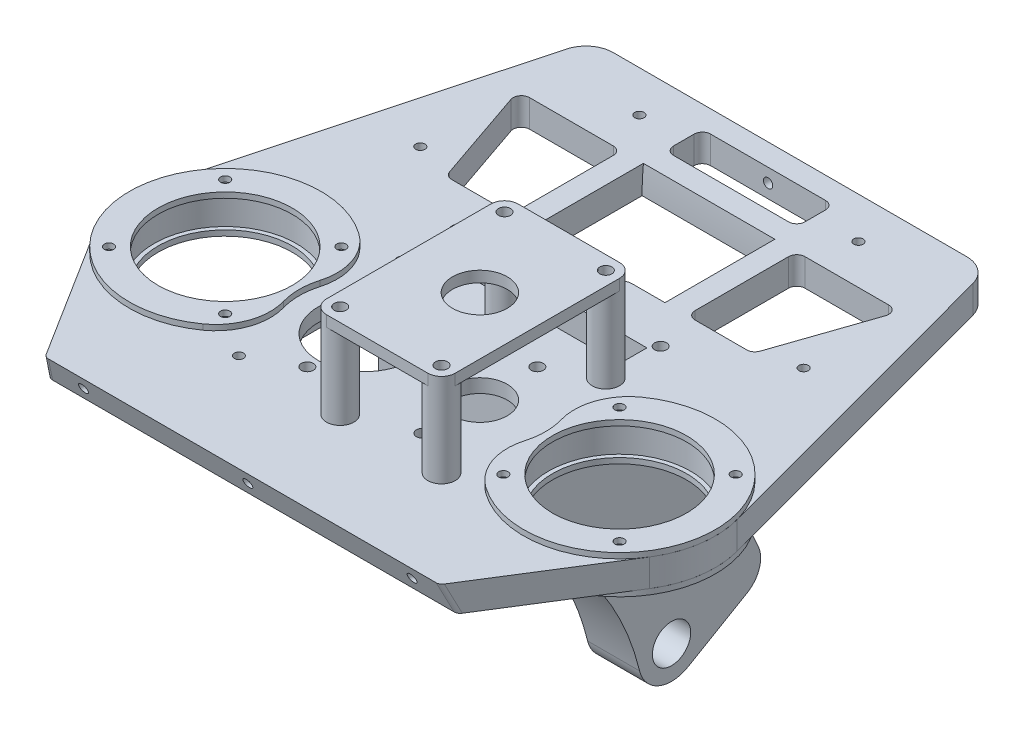
from build123d import *

# Parameters (mm, degrees)
EXTRUDE_1_DEPTH          = 2.5
EXTRUDE_1_DEPTH_BACK     = 2.5
SKETCH_1_R               = 13
SKETCH_1_R_2             = 1.1
SKETCH_1_R_3             = 5
SKETCH_1_R_4             = 8.5
SKETCH_1_R_5             = 0.85
SKETCH_2_R               = 1.1
SKETCH_2_R_2             = 12.25
EXTRUDE_2_DEPTH          = 1
MIRROR_START             = -3.5
MIRROR_1_OUTLINE_R       = 1.1
MIRROR_1_OUTLINE_R_2     = 12.25
MIRROR_1_DEPTH           = 1
MIRROR_START_2           = 2.5
MIRROR_1_2_OUTLINE_R     = 1.1
MIRROR_1_2_OUTLINE_R_2   = 12.25
MIRROR_1_2_DEPTH         = 1
EXTRUDE_START            = -1
SKETCH_38_R              = 1.1
SKETCH_38_R_2            = 0.85
EXTRUDE_10_DEPTH         = 1
SKETCH_3_W               = 36
SKETCH_3_H               = 26
CUT_EXTRUDE_1_DEPTH      = 2.5
SKETCH_6_R               = 1.1
EXTRUDE_3_DEPTH          = 2
SKETCH_16_R              = 3.5
EXTRUDE_6_DEPTH          = 6
EXTRUDE_7_DEPTH          = 33.5
EXTRUDE_7_DEPTH_BACK     = 3
SKETCH_17_R              = 3.5
CUT_EXTRUDE_7_DEPTH      = 12
CUT_EXTRUDE_7_DEPTH_BACK = 12
SKETCH_24_R              = 22.5
CUT_EXTRUDE_8_REACH      = 83.241
CUT_EXTRUDE_8_END_RADIUS = 22.5
SKETCH_25_W              = 34.5
SKETCH_25_H              = 5
CUT_EXTRUDE_9_DEPTH      = 4
CUT_EXTRUDE_9_DEPTH_BACK = 4
SKETCH_26_R              = 77.5
EXTRUDE_8_DEPTH          = 5
SKETCH_28_R              = 72.5
SKETCH_28_R_2            = 52.5
CUT_EXTRUDE_10_DEPTH     = 24
CUT_EXTRUDE_11_DEPTH     = 10
SKETCH_30_R              = 0.85
CUT_EXTRUDE_12_DEPTH     = 10
FILLET_1_R               = 5
SKETCH_31_R              = 0.85
CUT_EXTRUDE_13_DEPTH     = 100.843329311
SKETCH_32_R              = 0.85
CUT_EXTRUDE_14_DEPTH     = 100.843329311
SKETCH_33_W              = 34.5
SKETCH_33_H              = 5
CUT_EXTRUDE_15_DEPTH     = 98.384241066
EXTRUDE_START_2          = -5
EXTRUDE_9_DEPTH          = 5
CUT_EXTRUDE_16_DEPTH     = 133.551651849
CUT_EXTRUDE_START        = -10
SKETCH_36_R              = 0.85
CUT_EXTRUDE_17_DEPTH     = 10
SKETCH_39_R              = 2.5
SKETCH_39_R_2            = 1.1
EXTRUDE_11_DEPTH         = 15
EXTRUDE_11_2_DEPTH       = 15
EXTRUDE_11_3_DEPTH       = 15
EXTRUDE_11_4_DEPTH       = 15
CUT_EXTRUDE_START_2      = -2
SKETCH_40_R              = 5
CUT_EXTRUDE_18_DEPTH     = 2
CUT_EXTRUDE_19_DEPTH     = 10
FILLET_2_R               = 1
SKETCH_43_R              = 77.5
SKETCH_43_R_2            = 72.5
CUT_EXTRUDE_20_DEPTH     = 8
FILLET_3_R               = 2
SKETCH_44_R              = 1.1
CUT_EXTRUDE_21_DEPTH     = 100.843329432
SKETCH_45_R              = 0.85
CUT_EXTRUDE_22_DEPTH     = 10


# Read off the part's stored shape, not the designer's step: ﾐﾗｰ1
with BuildPart() as part:
    # ｽｹｯﾁ1 → ﾎﾞｽ - 押し出し1 (new, two sides: drawn at the far end of the back side and taken through both)
    with BuildSketch(Plane(origin=(0, 0, 0), x_dir=(1, 0, 0), z_dir=(0, 1, 0)).offset(-EXTRUDE_1_DEPTH_BACK)):
        with BuildLine():
            Line((-36, 17.5), (36, 17.5))
            ThreePointArc((36, 17.5), (53.5, 0), (36, -17.5))
            Line((36, -17.5), (-36, -17.5))
            ThreePointArc((-36, -17.5), (-53.5, 0), (-36, 17.5))
        make_face()
        with Locations(Location((-36, 0, 0), (0, 0, 270))):
            Circle(SKETCH_1_R, mode=Mode.SUBTRACT)
        with Locations(Location((36, 0, 0), (0, 0, 270))):
            Circle(SKETCH_1_R, mode=Mode.SUBTRACT)
        with Locations(Location((-46.606601718, 10.606601718, 0), (0, 0, 270))):
            Circle(SKETCH_1_R_2, mode=Mode.SUBTRACT)
        with Locations(Location((-25.393398282, 10.606601718, 0), (0, 0, 270))):
            Circle(SKETCH_1_R_2, mode=Mode.SUBTRACT)
        with Locations(Location((-25.393398282, -10.606601718, 0), (0, 0, 270))):
            Circle(SKETCH_1_R_2, mode=Mode.SUBTRACT)
        with Locations(Location((-46.606601718, -10.606601718, 0), (0, 0, 270))):
            Circle(SKETCH_1_R_2, mode=Mode.SUBTRACT)
        with Locations(Location((46.606601718, 10.606601718, 0), (0, 0, 90))):
            Circle(SKETCH_1_R_2, mode=Mode.SUBTRACT)
        with Locations(Location((46.606601718, -10.606601718, 0), (0, 0, 90))):
            Circle(SKETCH_1_R_2, mode=Mode.SUBTRACT)
        with Locations(Location((25.393398282, -10.606601718, 0), (0, 0, 90))):
            Circle(SKETCH_1_R_2, mode=Mode.SUBTRACT)
        with Locations(Location((25.393398282, 10.606601718, 0), (0, 0, 90))):
            Circle(SKETCH_1_R_2, mode=Mode.SUBTRACT)
        with Locations(Location((-10.5, 10.5, 0), (0, 0, 270))):
            Circle(SKETCH_1_R_2, mode=Mode.SUBTRACT)
        with Locations(Location((-10.5, -10.5, 0), (0, 0, 90))):
            Circle(SKETCH_1_R_2, mode=Mode.SUBTRACT)
        with Locations(Location((10.5, -10.5, 0), (0, 0, 270))):
            Circle(SKETCH_1_R_2, mode=Mode.SUBTRACT)
        with Locations(Location((10.5, 10.5, 0), (0, 0, 90))):
            Circle(SKETCH_1_R_2, mode=Mode.SUBTRACT)
        with Locations(Location((10.5, 0, 0), (0, 0, 270))):
            Circle(SKETCH_1_R_3, mode=Mode.SUBTRACT)
        with Locations(Location((-10.5, 0, 0), (0, 0, 270))):
            Circle(SKETCH_1_R_4, mode=Mode.SUBTRACT)
        with Locations(Location((0, 15, 0), (0, 0, 270))):
            Circle(SKETCH_1_R_5, mode=Mode.SUBTRACT)
        with Locations(Location((0, -15, 0), (0, 0, 90))):
            Circle(SKETCH_1_R_5, mode=Mode.SUBTRACT)
        with Locations(Location((18.5, -15, 0), (0, 0, 270))):
            Circle(SKETCH_1_R_2, mode=Mode.SUBTRACT)
        with Locations(Location((18.5, 15, 0), (0, 0, 90))):
            Circle(SKETCH_1_R_2, mode=Mode.SUBTRACT)
        with Locations(Location((-18.5, 15, 0), (0, 0, 270))):
            Circle(SKETCH_1_R_2, mode=Mode.SUBTRACT)
        with Locations(Location((-18.5, -15, 0), (0, 0, 270))):
            Circle(SKETCH_1_R_5, mode=Mode.SUBTRACT)
    extrude(amount=EXTRUDE_1_DEPTH + EXTRUDE_1_DEPTH_BACK)

    # ｽｹｯﾁ3 → ｶｯﾄ - 押し出し1 (cut)
    with BuildSketch(Plane.XZ.offset(2.5)):
        with Locations((-2.5, 0)):
            Rectangle(SKETCH_3_W, SKETCH_3_H)
    extrude(amount=-CUT_EXTRUDE_1_DEPTH, mode=Mode.SUBTRACT)


with BuildPart() as body_2:
    # ｽｹｯﾁ2 → ﾎﾞｽ - 押し出し2 (new body)
    with BuildSketch(Plane(origin=(0, 2.5, 0), x_dir=(1, 0, 0), z_dir=(0, 1, 0))):
        with BuildLine():
            ThreePointArc((-25.820261438, 14.234567883), (-53.5, 0), (-25.820261438, -14.234567883))
            ThreePointArc((-25.820261438, -14.234567883), (-22.191510142, -9.383501212), (-22.029411765, -3.327561323))
            ThreePointArc((-22.029411765, -3.327561323), (-22.5, 0), (-22.029411765, 3.327561323))
            ThreePointArc((-22.029411765, 3.327561323), (-22.191510142, 9.383501212), (-25.820261438, 14.234567883))
        make_face()
        with Locations(Location((-25.393398282, 10.606601718, 0), (0, 0, 270))):
            Circle(SKETCH_2_R, mode=Mode.SUBTRACT)
        with Locations(Location((-25.393398282, -10.606601718, 0), (0, 0, 270))):
            Circle(SKETCH_2_R, mode=Mode.SUBTRACT)
        with Locations(Location((-46.606601718, -10.606601718, 0), (0, 0, 270))):
            Circle(SKETCH_2_R, mode=Mode.SUBTRACT)
        with Locations(Location((-46.606601718, 10.606601718, 0), (0, 0, 270))):
            Circle(SKETCH_2_R, mode=Mode.SUBTRACT)
        with Locations(Location((-36, 0, 0), (0, 0, 270))):
            Circle(SKETCH_2_R_2, mode=Mode.SUBTRACT)
    extrude(amount=EXTRUDE_2_DEPTH)



with BuildPart() as body_3:
    # ﾐﾗｰ1 outline → ﾐﾗｰ1 (new body)
    # profile 1 of 2: a face of its own
    with BuildSketch(Plane(origin=(0, 0, 0), x_dir=(1, 0, 0), z_dir=(0, 1, 0)).offset(MIRROR_START)):
        with BuildLine():
            ThreePointArc((25.820261438, -14.234567883), (53.5, 0), (25.820261438, 14.234567883))
            ThreePointArc((25.820261438, 14.234567883), (22.191510142, 9.383501212), (22.029411765, 3.327561323))
            ThreePointArc((22.029411765, 3.327561323), (22.5, 0), (22.029411765, -3.327561323))
            ThreePointArc((22.029411765, -3.327561323), (22.191510142, -9.383501212), (25.820261438, -14.234567883))
        make_face()
        with Locations((25.393398282, -10.606601718)):
            Circle(MIRROR_1_OUTLINE_R, mode=Mode.SUBTRACT)
        with Locations((46.606601718, -10.606601718)):
            Circle(MIRROR_1_OUTLINE_R, mode=Mode.SUBTRACT)
        with Locations((36, 0)):
            Circle(MIRROR_1_OUTLINE_R_2, mode=Mode.SUBTRACT)
        with Locations((25.393398282, 10.606601718)):
            Circle(MIRROR_1_OUTLINE_R, mode=Mode.SUBTRACT)
        with Locations((46.606601718, 10.606601718)):
            Circle(MIRROR_1_OUTLINE_R, mode=Mode.SUBTRACT)
    # profile 2 of 2: a face of its own
    with BuildSketch(Plane(origin=(0, 0, 0), x_dir=(1, 0, 0), z_dir=(0, 1, 0)).offset(MIRROR_START)):
        with BuildLine():
            ThreePointArc((-22.029411765, -3.327561323), (-22.5, 0), (-22.029411765, 3.327561323))
            ThreePointArc((-22.029411765, 3.327561323), (-22.191510142, 9.383501212), (-25.820261438, 14.234567883))
            ThreePointArc((-25.820261438, 14.234567883), (-53.5, 0), (-25.820261438, -14.234567883))
            ThreePointArc((-25.820261438, -14.234567883), (-22.191510142, -9.383501212), (-22.029411765, -3.327561323))
        make_face()
        with Locations((-46.606601718, -10.606601718)):
            Circle(MIRROR_1_OUTLINE_R, mode=Mode.SUBTRACT)
        with Locations((-25.393398282, -10.606601718)):
            Circle(MIRROR_1_OUTLINE_R, mode=Mode.SUBTRACT)
        with Locations((-36, 0)):
            Circle(MIRROR_1_OUTLINE_R_2, mode=Mode.SUBTRACT)
        with Locations((-46.606601718, 10.606601718)):
            Circle(MIRROR_1_OUTLINE_R, mode=Mode.SUBTRACT)
        with Locations((-25.393398282, 10.606601718)):
            Circle(MIRROR_1_OUTLINE_R, mode=Mode.SUBTRACT)
    extrude(amount=MIRROR_1_DEPTH)


with BuildPart() as body_4:
    # Mirror 1 2 outline → Mirror 1 2 (new body)
    with BuildSketch(Plane(origin=(0, 0, 0), x_dir=(1, 0, 0), z_dir=(0, 1, 0)).offset(MIRROR_START_2)):
        with BuildLine():
            ThreePointArc((25.820261438, -14.234567883), (53.5, 0), (25.820261438, 14.234567883))
            ThreePointArc((25.820261438, 14.234567883), (22.191510142, 9.383501212), (22.029411765, 3.327561323))
            ThreePointArc((22.029411765, 3.327561323), (22.5, 0), (22.029411765, -3.327561323))
            ThreePointArc((22.029411765, -3.327561323), (22.191510142, -9.383501212), (25.820261438, -14.234567883))
        make_face()
        with Locations((25.393398282, -10.606601718)):
            Circle(MIRROR_1_2_OUTLINE_R, mode=Mode.SUBTRACT)
        with Locations((46.606601718, -10.606601718)):
            Circle(MIRROR_1_2_OUTLINE_R, mode=Mode.SUBTRACT)
        with Locations((36, 0)):
            Circle(MIRROR_1_2_OUTLINE_R_2, mode=Mode.SUBTRACT)
        with Locations((25.393398282, 10.606601718)):
            Circle(MIRROR_1_2_OUTLINE_R, mode=Mode.SUBTRACT)
        with Locations((46.606601718, 10.606601718)):
            Circle(MIRROR_1_2_OUTLINE_R, mode=Mode.SUBTRACT)
    extrude(amount=MIRROR_1_2_DEPTH)


with BuildPart() as body_2_1:
    add(body_2.part)

    add(body_4.part)  # ﾎﾞｽ - 押し出し10 merges body 4
    # ｽｹｯﾁ38 → ﾎﾞｽ - 押し出し10 (add)
    # profile 1 of 8: a face of its own
    with BuildSketch(Plane(origin=(0, 3.5, 0), x_dir=(1, 0, 0), z_dir=(0, 1, 0)).offset(EXTRUDE_START)):
        with Locations(Location((46.606601718, -10.606601718, 0), (0, 0, 270))):
            Circle(SKETCH_38_R)
        with Locations(Location((46.606601718, -10.606601718, 0), (0, 0, 270))):
            Circle(SKETCH_38_R_2, mode=Mode.SUBTRACT)
    # profile 2 of 8: a face of its own
    with BuildSketch(Plane(origin=(0, 3.5, 0), x_dir=(1, 0, 0), z_dir=(0, 1, 0)).offset(EXTRUDE_START)):
        with Locations(Location((46.606601718, 10.606601718, 0), (0, 0, 270))):
            Circle(SKETCH_38_R)
        with Locations(Location((46.606601718, 10.606601718, 0), (0, 0, 270))):
            Circle(SKETCH_38_R_2, mode=Mode.SUBTRACT)
    # profile 3 of 8: a face of its own
    with BuildSketch(Plane(origin=(0, 3.5, 0), x_dir=(1, 0, 0), z_dir=(0, 1, 0)).offset(EXTRUDE_START)):
        with Locations(Location((25.393398282, 10.606601718, 0), (0, 0, 270))):
            Circle(SKETCH_38_R)
        with Locations(Location((25.393398282, 10.606601718, 0), (0, 0, 270))):
            Circle(SKETCH_38_R_2, mode=Mode.SUBTRACT)
    # profile 4 of 8: a face of its own
    with BuildSketch(Plane(origin=(0, 3.5, 0), x_dir=(1, 0, 0), z_dir=(0, 1, 0)).offset(EXTRUDE_START)):
        with Locations(Location((25.393398282, -10.606601718, 0), (0, 0, 270))):
            Circle(SKETCH_38_R)
        with Locations(Location((25.393398282, -10.606601718, 0), (0, 0, 270))):
            Circle(SKETCH_38_R_2, mode=Mode.SUBTRACT)
    # profile 5 of 8: a face of its own
    with BuildSketch(Plane(origin=(0, 3.5, 0), x_dir=(1, 0, 0), z_dir=(0, 1, 0)).offset(EXTRUDE_START)):
        with Locations(Location((-25.393398282, 10.606601718, 0), (0, 0, 270))):
            Circle(SKETCH_38_R)
        with Locations(Location((-25.393398282, 10.606601718, 0), (0, 0, 270))):
            Circle(SKETCH_38_R_2, mode=Mode.SUBTRACT)
    # profile 6 of 8: a face of its own
    with BuildSketch(Plane(origin=(0, 3.5, 0), x_dir=(1, 0, 0), z_dir=(0, 1, 0)).offset(EXTRUDE_START)):
        with Locations(Location((-25.393398282, -10.606601718, 0), (0, 0, 270))):
            Circle(SKETCH_38_R)
        with Locations(Location((-25.393398282, -10.606601718, 0), (0, 0, 270))):
            Circle(SKETCH_38_R_2, mode=Mode.SUBTRACT)
    # profile 7 of 8: a face of its own
    with BuildSketch(Plane(origin=(0, 3.5, 0), x_dir=(1, 0, 0), z_dir=(0, 1, 0)).offset(EXTRUDE_START)):
        with Locations(Location((-46.606601718, -10.606601718, 0), (0, 0, 270))):
            Circle(SKETCH_38_R)
        with Locations(Location((-46.606601718, -10.606601718, 0), (0, 0, 270))):
            Circle(SKETCH_38_R_2, mode=Mode.SUBTRACT)
    # profile 8 of 8: a face of its own
    with BuildSketch(Plane(origin=(0, 3.5, 0), x_dir=(1, 0, 0), z_dir=(0, 1, 0)).offset(EXTRUDE_START)):
        with Locations(Location((-46.606601718, 10.606601718, 0), (0, 0, 270))):
            Circle(SKETCH_38_R)
        with Locations(Location((-46.606601718, 10.606601718, 0), (0, 0, 270))):
            Circle(SKETCH_38_R_2, mode=Mode.SUBTRACT)
    extrude(amount=EXTRUDE_10_DEPTH)


with BuildPart() as body_4_2:
    # ｽｹｯﾁ6 → ﾎﾞｽ - 押し出し3 (new body)
    with BuildSketch(Plane(origin=(0, 17.5, 0), x_dir=(1, 0, 0), z_dir=(0, 1, 0))):
        with BuildLine():
            Line((-2.5, -15), (-2.5, 15))
            ThreePointArc((-2.5, 15), (-1.767766953, 16.767766953), (0, 17.5))
            Line((0, 17.5), (18.5, 17.5))
            ThreePointArc((18.5, 17.5), (20.267766953, 16.767766953), (21, 15))
            Line((21, 15), (21, -15))
            ThreePointArc((21, -15), (20.267766953, -16.767766953), (18.5, -17.5))
            Line((18.5, -17.5), (0, -17.5))
            ThreePointArc((0, -17.5), (-1.767766953, -16.767766953), (-2.5, -15))
        make_face()
        with Locations(Location((18.5, 15, 0), (0, 0, 270))):
            Circle(SKETCH_6_R, mode=Mode.SUBTRACT)
        with Locations(Location((18.5, -15, 0), (0, 0, 270))):
            Circle(SKETCH_6_R, mode=Mode.SUBTRACT)
        with Locations(Location((0, -15, 0), (0, 0, 270))):
            Circle(SKETCH_6_R, mode=Mode.SUBTRACT)
        with Locations(Location((0, 15, 0), (0, 0, 270))):
            Circle(SKETCH_6_R, mode=Mode.SUBTRACT)
    extrude(amount=EXTRUDE_3_DEPTH)

    # ｽｹｯﾁ40 → ｶｯﾄ - 押し出し18 (cut)
    with BuildSketch(Plane(origin=(0, 19.5, 0), x_dir=(1, 0, 0), z_dir=(0, 1, 0)).offset(CUT_EXTRUDE_START_2)):
        with Locations(Location((10.5, 0, 0), (0, 0, 270))):
            Circle(SKETCH_40_R)
    extrude(amount=CUT_EXTRUDE_18_DEPTH, mode=Mode.SUBTRACT)


with BuildPart() as body_5:
    # ｽｹｯﾁ16 → ﾎﾞｽ - 押し出し6 (new body)
    with BuildSketch(Plane.ZY.offset(-15.5)):
        with BuildLine():
            Line((-17.5, -2.5), (17.5, -2.5))
            Line((17.5, -2.5), (17.5, -6.361311567))
            ThreePointArc((17.5, -6.361311567), (17.199778308, -7.261607081), (16.41929065, -7.801518272))
            ThreePointArc((16.41929065, -7.801518272), (-5.717751854, -21.227741547), (-18.171895109, -43.925900901))
            ThreePointArc((-18.171895109, -43.925900901), (-21.653600917, -48.022174512), (-27.019056708, -47.685103335))
            Line((-27.019056708, -47.685103335), (-37.787855918, -41.414907083))
            ThreePointArc((-37.787855918, -41.414907083), (-40.062610236, -38.525705895), (-39.746207725, -34.862117467))
            ThreePointArc((-39.746207725, -34.862117467), (-34.627518489, -21.392901217), (-32.273619314, -7.177419355))
            ThreePointArc((-32.273619314, -7.177419355), (-30.703619064, -3.852199072), (-27.284035992, -2.5))
            Line((-27.284035992, -2.5), (-17.5, -2.5))
        make_face()
        with Locations((-24, -42.5)):
            Circle(SKETCH_16_R, mode=Mode.SUBTRACT)
    extrude(amount=-EXTRUDE_6_DEPTH)

    # ｽｹｯﾁ17 → ﾎﾞｽ - 押し出し7 (add, two sides: drawn at the far end of the back side and taken through both)
    with BuildSketch(Plane(origin=(-18, 0, 0), x_dir=(0, 0, -1), z_dir=(1, 0, 0)).offset(-EXTRUDE_7_DEPTH_BACK)):
        with BuildLine():
            Line((13, -2.5), (13, -28.442279242))
            ThreePointArc((13, -28.442279242), (13.279075591, -30.78826062), (14.100725725, -33.00330077))
            ThreePointArc((14.100725725, -33.00330077), (16.455701543, -38.345554514), (18.171895109, -43.925900901))
            ThreePointArc((18.171895109, -43.925900901), (21.653600917, -48.022174512), (27.019056708, -47.685103335))
            Line((27.019056708, -47.685103335), (37.787855918, -41.414907083))
            ThreePointArc((37.787855918, -41.414907083), (40.062610236, -38.525705895), (39.746207725, -34.862117467))
            ThreePointArc((39.746207725, -34.862117467), (34.627518489, -21.392901217), (32.273619314, -7.177419355))
            ThreePointArc((32.273619314, -7.177419355), (30.703619064, -3.852199072), (27.284035992, -2.5))
            Line((27.284035992, -2.5), (13, -2.5))
        make_face()
        with Locations(Location((24, -42.5, 0), (0, 0, 180))):
            Circle(SKETCH_17_R, mode=Mode.SUBTRACT)
    extrude(amount=EXTRUDE_7_DEPTH + EXTRUDE_7_DEPTH_BACK)

    # ｽｹｯﾁ24 → ｶｯﾄ - 押し出し7 (cut, two sides: drawn at the far end of the back side and taken through both)
    with BuildSketch(Plane(origin=(0, 0, 0), x_dir=(0, 0, -1), z_dir=(1, 0, 0)).offset(-CUT_EXTRUDE_7_DEPTH_BACK)):
        with Locations((24, -42.5)):
            Circle(SKETCH_24_R)
    extrude(amount=CUT_EXTRUDE_7_DEPTH + CUT_EXTRUDE_7_DEPTH_BACK, mode=Mode.SUBTRACT)

    # ｶｯﾄ - 押し出し8: up to this cylinder (the profile starts outside it)
    cut_extrude_8_end = Plane(origin=(0.25, -42.5, -24), z_dir=(-1, 0, 0)) * Cylinder(CUT_EXTRUDE_8_END_RADIUS, 212.482, mode=Mode.PRIVATE)
    # ｽｹｯﾁ25 → ｶｯﾄ - 押し出し8 (cut, up to the surface)
    with BuildSketch(Plane(origin=(0, -2.5, 0), x_dir=(1, 0, 0), z_dir=(0, 1, 0)), mode=Mode.PRIVATE) as cut_extrude_8_sk1:
        with Locations((0.25, 21)):
            Rectangle(SKETCH_25_W, SKETCH_25_H)
    cut_extrude_8_tool1 = extrude(cut_extrude_8_sk1.sketch, amount=-CUT_EXTRUDE_8_REACH, mode=Mode.PRIVATE) - cut_extrude_8_end
    add(cut_extrude_8_tool1.solids().sort_by_distance((0.25, -2.5, -21))[0], mode=Mode.SUBTRACT)

    # ｽｹｯﾁ26 → ｶｯﾄ - 押し出し9 (cut, two sides: drawn at the far end of the back side and taken through both)
    with BuildSketch(Plane(origin=(0, 0, 0), x_dir=(0, 0, -1), z_dir=(1, 0, 0)).offset(-CUT_EXTRUDE_9_DEPTH_BACK)):
        with Locations((104.622577483, -2.5)):
            Circle(SKETCH_26_R)
    extrude(amount=CUT_EXTRUDE_9_DEPTH + CUT_EXTRUDE_9_DEPTH_BACK, mode=Mode.SUBTRACT)

    # ｽｹｯﾁ45 → ｶｯﾄ - 押し出し22 (cut)
    with BuildSketch(Plane(origin=(0, -2.5, 0), x_dir=(1, 0, 0), z_dir=(0, 1, 0))):
        with Locations(Location((-18.5, 25, 0), (0, 0, 270))):
            Circle(SKETCH_45_R)
        with Locations(Location((-18.5, 15, 0), (0, 0, 270))):
            Circle(SKETCH_45_R)
        with Locations(Location((18.5, 25, 0), (0, 0, 270))):
            Circle(SKETCH_45_R)
        with Locations(Location((18.5, 15, 0), (0, 0, 270))):
            Circle(SKETCH_45_R)
        with Locations(Location((18.5, -15, 0), (0, 0, 270))):
            Circle(SKETCH_45_R)
    extrude(amount=-CUT_EXTRUDE_22_DEPTH, mode=Mode.SUBTRACT)


with BuildPart() as body_6:
    # ｽｹｯﾁ27 → ﾎﾞｽ - 押し出し8 (new body)
    with BuildSketch(Plane(origin=(0, 2.5, 0), x_dir=(1, 0, 0), z_dir=(0, 1, 0))):
        with BuildLine():
            Line((52.901635865, 4.537037037), (36, 67.5))
            Line((36, 67.5), (-36, 67.5))
            Line((-36, 67.5), (-52.901635865, 4.537037037))
            ThreePointArc((-52.901635865, 4.537037037), (-46.65016084, 13.886110833), (-36, 17.5))
            Line((-36, 17.5), (36, 17.5))
            ThreePointArc((36, 17.5), (46.65016084, 13.886110833), (52.901635865, 4.537037037))
        make_face()
    extrude(amount=-EXTRUDE_8_DEPTH)

    # ｽｹｯﾁ28 → ｶｯﾄ - 押し出し10 (cut)
    with BuildSketch(Plane.ZY.offset(-12)):
        with Locations((-104.622577483, -2.5)):
            Circle(SKETCH_28_R)
        with Locations((-104.622577483, -2.5)):
            Circle(SKETCH_28_R_2, mode=Mode.SUBTRACT)
    extrude(amount=CUT_EXTRUDE_10_DEPTH, mode=Mode.SUBTRACT)


with BuildPart() as part_1:
    add(part.part)

    # Combine 2: union body 6
    add(body_6.part)

    # ｽｹｯﾁ29 → ｶｯﾄ - 押し出し11 (cut)
    with BuildSketch(Plane(origin=(0, 2.5, 0), x_dir=(1, 0, 0), z_dir=(0, 1, 0))):
        Polygon((-36.10131445, 67.122577483), (36.10131445, 67.122577483), (36, 67.5), (-36, 67.5), align=None)
    extrude(amount=-CUT_EXTRUDE_11_DEPTH, mode=Mode.SUBTRACT)

    # ｽｹｯﾁ30 → ｶｯﾄ - 押し出し12 (cut)
    with BuildSketch(Plane(origin=(0, 0, -67.122577483), x_dir=(-1, 0, 0), z_dir=(0, 0, -1))):
        with Locations((-30, 0)):
            Circle(SKETCH_30_R)
        with Locations((30, 0)):
            Circle(SKETCH_30_R)
        Circle(SKETCH_30_R)
    extrude(amount=-CUT_EXTRUDE_12_DEPTH, mode=Mode.SUBTRACT)

    # ﾌｨﾚｯﾄ1
    fillet_1_edges = [part_1.edges().sort_by_distance(p)[0] for p in [
        (36.10131445, 0, -67.122577483),
        (-36.10131445, 0, -67.122577483),
    ]]
    fillet(fillet_1_edges, radius=FILLET_1_R)

    # ｽｹｯﾁ31 → ｶｯﾄ - 押し出し13 (cut, through all)
    with BuildSketch(Plane(origin=(0, 2.5, 0), x_dir=(1, 0, 0), z_dir=(0, 1, 0))):
        with Locations(Location((20, 59.622577483, 0), (0, 0, 270))):
            Circle(SKETCH_31_R)
        with Locations(Location((-20, 59.622577483, 0), (0, 0, 270))):
            Circle(SKETCH_31_R)
    extrude(amount=-CUT_EXTRUDE_13_DEPTH, mode=Mode.SUBTRACT)

    # ｽｹｯﾁ32 → ｶｯﾄ - 押し出し14 (cut, through all)
    with BuildSketch(Plane(origin=(0, 2.5, 0), x_dir=(1, 0, 0), z_dir=(0, 1, 0))):
        with Locations(Location((-35, 34.622577483, 0), (0, 0, 270))):
            Circle(SKETCH_32_R)
        with Locations(Location((35, 34.622577483, 0), (0, 0, 270))):
            Circle(SKETCH_32_R)
    extrude(amount=-CUT_EXTRUDE_14_DEPTH, mode=Mode.SUBTRACT)

    # ｽｹｯﾁ33 → ｶｯﾄ - 押し出し15 (cut, through all)
    with BuildSketch(Plane.XZ.offset(2.5)):
        with Locations((0.25, -21)):
            Rectangle(SKETCH_33_W, SKETCH_33_H)
    extrude(amount=-CUT_EXTRUDE_15_DEPTH, mode=Mode.SUBTRACT)

    # ｽｹｯﾁ34 → ﾎﾞｽ - 押し出し9 (add)
    with BuildSketch(Plane(origin=(0, 2.5, 0), x_dir=(1, 0, 0), z_dir=(0, 1, 0)).offset(EXTRUDE_START_2)):
        with BuildLine():
            ThreePointArc((-36, -17.5), (-44.462836356, -15.317649977), (-50.814944584, -9.31490295))
            Line((-50.814944584, -9.31490295), (-36, -32.877422517))
            Line((-36, -32.877422517), (36, -32.877422517))
            Line((36, -32.877422517), (50.814944584, -9.31490295))
            ThreePointArc((50.814944584, -9.31490295), (44.462836356, -15.317649977), (36, -17.5))
            Line((36, -17.5), (-36, -17.5))
        make_face()
    extrude(amount=EXTRUDE_9_DEPTH)

    # ｽｹｯﾁ35 → ｶｯﾄ - 押し出し16 (cut, through all)
    with BuildSketch(Plane(origin=(-50, 0, 0), x_dir=(0, 0, -1), z_dir=(1, 0, 0))):
        Polygon((-32.877422517, 2.5), (-32.877422517, -2.5), (-30.857291388, -2.5), align=None)
    extrude(amount=CUT_EXTRUDE_16_DEPTH, mode=Mode.SUBTRACT)

    # ｽｹｯﾁ36 → ｶｯﾄ - 押し出し17 (cut)
    with BuildSketch(Plane.XY.offset(32.877422517).offset(CUT_EXTRUDE_START)):
        with Locations(Location((0, 0, 0), (0, 0, 180))):
            Circle(SKETCH_36_R)
        with Locations(Location((-30, 0, 0), (0, 0, 180))):
            Circle(SKETCH_36_R)
        with Locations(Location((30, 0, 0), (0, 0, 180))):
            Circle(SKETCH_36_R)
    extrude(amount=CUT_EXTRUDE_17_DEPTH, mode=Mode.SUBTRACT)

    # ｽｹｯﾁ41 → ｶｯﾄ - 押し出し19 (cut)
    with BuildSketch(Plane(origin=(0, 2.5, 0), x_dir=(1, 0, 0), z_dir=(0, 1, 0))):
        with BuildLine():
            Line((-10.5, 63.122577483), (10.5, 63.122577483))
            ThreePointArc((10.5, 63.122577483), (11.560660172, 62.683237655), (12, 61.622577483))
            Line((12, 61.622577483), (12, 57.861215082))
            ThreePointArc((12, 57.861215082), (11.560660172, 56.80055491), (10.5, 56.361215082))
            Line((10.5, 56.361215082), (-10.5, 56.361215082))
            ThreePointArc((-10.5, 56.361215082), (-11.560660172, 56.80055491), (-12, 57.861215082))
            Line((-12, 57.861215082), (-12, 61.622577483))
            ThreePointArc((-12, 61.622577483), (-11.560660172, 62.683237655), (-10.5, 63.122577483))
        make_face()
        with BuildLine():
            Line((-32.786111604, 52.361215082), (-17.5, 52.361215082))
            ThreePointArc((-17.5, 52.361215082), (-16.439339828, 51.921875254), (-16, 50.861215082))
            Line((-16, 50.861215082), (-16, 33.795196776))
            ThreePointArc((-16, 33.795196776), (-16.439339828, 32.734536604), (-17.5, 32.295196776))
            Line((-17.5, 32.295196776), (-26.928926425, 32.295196776))
            ThreePointArc((-26.928926425, 32.295196776), (-27.800592403, 32.57445994), (-28.347692782, 33.308265546))
            Line((-28.347692782, 33.308265546), (-34.204877962, 50.374283852))
            ThreePointArc((-34.204877962, 50.374283852), (-34.00684844, 51.73288106), (-32.786111604, 52.361215082))
        make_face()
        with BuildLine():
            Line((28.347692782, 33.308265546), (34.204877962, 50.374283852))
            ThreePointArc((34.204877962, 50.374283852), (34.00684844, 51.73288106), (32.786111604, 52.361215082))
            Line((32.786111604, 52.361215082), (17.5, 52.361215082))
            ThreePointArc((17.5, 52.361215082), (16.439339828, 51.921875254), (16, 50.861215082))
            Line((16, 50.861215082), (16, 33.795196776))
            ThreePointArc((16, 33.795196776), (16.439339828, 32.734536604), (17.5, 32.295196776))
            Line((17.5, 32.295196776), (26.928926425, 32.295196776))
            ThreePointArc((26.928926425, 32.295196776), (27.800592403, 32.57445994), (28.347692782, 33.308265546))
        make_face()
    extrude(amount=-CUT_EXTRUDE_19_DEPTH, mode=Mode.SUBTRACT)

    # ﾌｨﾚｯﾄ2
    fillet_2_edges = [part_1.edges().sort_by_distance(p)[0] for p in [
        (36.63507917, 0, 31.867356952),
        (-36.63507917, 0, 31.867356952),
    ]]
    fillet(fillet_2_edges, radius=FILLET_2_R)

    # ｽｹｯﾁ43 → ｶｯﾄ - 押し出し20 (cut)
    with BuildSketch(Plane.ZY.offset(-4)):
        with Locations((-104.622577483, -2.5)):
            Circle(SKETCH_43_R)
        with Locations((-104.622577483, -2.5)):
            Circle(SKETCH_43_R_2, mode=Mode.SUBTRACT)
    extrude(amount=CUT_EXTRUDE_20_DEPTH, mode=Mode.SUBTRACT)

    # ﾌｨﾚｯﾄ3
    fillet_3_edges = [part_1.edges().sort_by_distance(p)[0] for p in [
        (4, 0.001489427, -32.165745157),
        (-4, 0.001489427, -32.165745157),
    ]]
    fillet(fillet_3_edges, radius=FILLET_3_R)

    # ｽｹｯﾁ44 → ｶｯﾄ - 押し出し21 (cut, through all)
    with BuildSketch(Plane(origin=(0, 2.5, 0), x_dir=(1, 0, 0), z_dir=(0, 1, 0))):
        with Locations(Location((18.5, 25, 0), (0, 0, 270))):
            Circle(SKETCH_44_R)
        with Locations(Location((-18.5, 25, 0), (0, 0, 270))):
            Circle(SKETCH_44_R)
    extrude(amount=-CUT_EXTRUDE_21_DEPTH, mode=Mode.SUBTRACT)


with BuildPart() as body_6_2:
    # ｽｹｯﾁ39 → ﾎﾞｽ - 押し出し11 (new body)
    with BuildSketch(Plane(origin=(0, 2.5, 0), x_dir=(1, 0, 0), z_dir=(0, 1, 0))):
        with Locations(Location((0, -15, 0), (0, 0, 90))):
            Circle(SKETCH_39_R)
        with Locations(Location((0, -15, 0), (0, 0, 90))):
            Circle(SKETCH_39_R_2, mode=Mode.SUBTRACT)
    extrude(amount=EXTRUDE_11_DEPTH)


with BuildPart() as body_7:
    # ｽｹｯﾁ39 → Extrude 11 2 (new body)
    with BuildSketch(Plane(origin=(0, 2.5, 0), x_dir=(1, 0, 0), z_dir=(0, 1, 0))):
        with Locations(Location((18.5, -15, 0), (0, 0, 90))):
            Circle(SKETCH_39_R)
        with Locations(Location((18.5, -15, 0), (0, 0, 270))):
            Circle(SKETCH_39_R_2, mode=Mode.SUBTRACT)
    extrude(amount=EXTRUDE_11_2_DEPTH)


with BuildPart() as body_8:
    # ｽｹｯﾁ39 → Extrude 11 3 (new body)
    with BuildSketch(Plane(origin=(0, 2.5, 0), x_dir=(1, 0, 0), z_dir=(0, 1, 0))):
        with Locations(Location((18.5, 15, 0), (0, 0, 90))):
            Circle(SKETCH_39_R)
        with Locations(Location((18.5, 15, 0), (0, 0, 90))):
            Circle(SKETCH_39_R_2, mode=Mode.SUBTRACT)
    extrude(amount=EXTRUDE_11_3_DEPTH)


with BuildPart() as body_9:
    # ｽｹｯﾁ39 → Extrude 11 4 (new body)
    with BuildSketch(Plane(origin=(0, 2.5, 0), x_dir=(1, 0, 0), z_dir=(0, 1, 0))):
        with Locations(Location((0, 15, 0), (0, 0, 90))):
            Circle(SKETCH_39_R)
        with Locations(Location((0, 15, 0), (0, 0, 90))):
            Circle(SKETCH_39_R_2, mode=Mode.SUBTRACT)
    extrude(amount=EXTRUDE_11_4_DEPTH)


with BuildPart() as body_4_2_1:
    add(body_4_2.part)

    # Combine 3: union body 6 2, body 7, body 8, body 9
    add(body_6_2.part)
    add(body_7.part)
    add(body_8.part)
    add(body_9.part)


solid = Compound([body_3.part, body_2_1.part, body_5.part, part_1.part, body_4_2_1.part])
